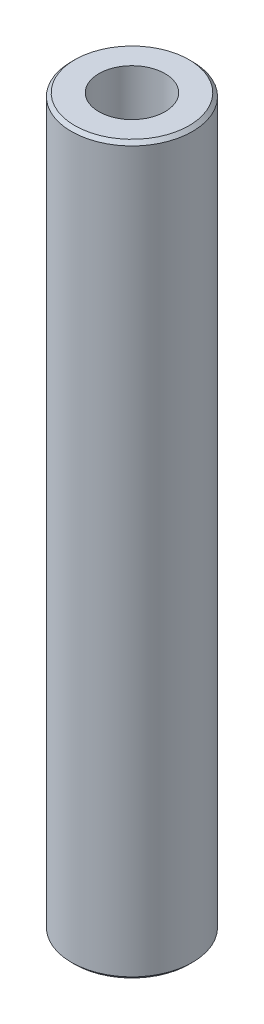
from build123d import *

# Parameters (mm, degrees)
SKETCH1_R           = 50
BOSS_EXTRUDE1_DEPTH = 600
SKETCH2_R           = 27.305239267
CUT_EXTRUDE1_DEPTH  = 605.15229868
CHAMFER1_SIZE       = 2.792995096


with BuildPart() as part:
    # Sketch1 → Boss-Extrude1 (new body)
    with BuildSketch(Plane(origin=(0, 0, 0), x_dir=(1, 0, 0), z_dir=(0, 1, 0))):
        Circle(SKETCH1_R)
    extrude(amount=BOSS_EXTRUDE1_DEPTH)

    # Sketch2 → Cut-Extrude1 (cut, through all)
    with BuildSketch(Plane(origin=(0, 0, 0), x_dir=(1, 0, 0), z_dir=(0, 1, 0))):
        Circle(SKETCH2_R)
    extrude(amount=CUT_EXTRUDE1_DEPTH, mode=Mode.SUBTRACT)

    # Chamfer1
    chamfer1_edges = [part.edges().sort_by_distance(p)[0] for p in [
        (-50, 600, 0),
        (-50, 0, 0),
    ]]
    chamfer(chamfer1_edges, length=CHAMFER1_SIZE)


solid = part.part
